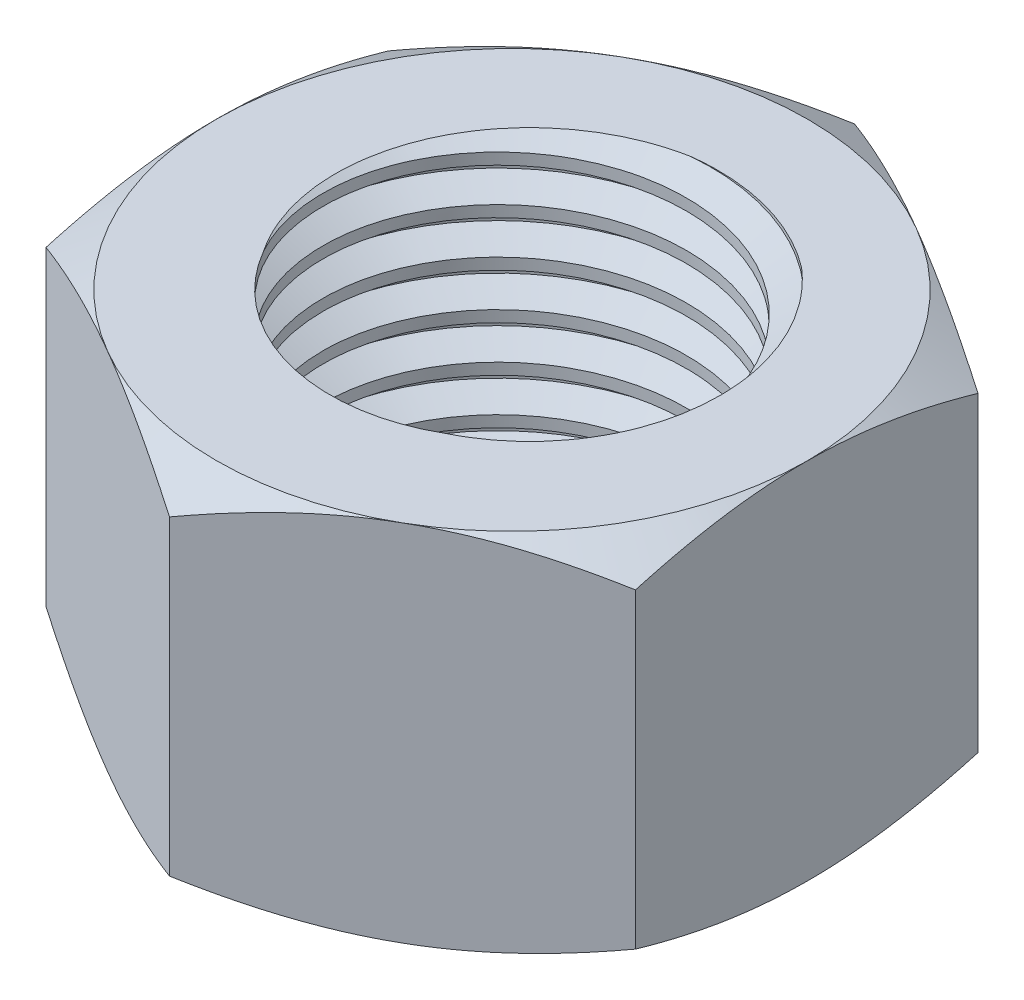
from build123d import *

# Parameters (mm, degrees)
SKETCH1_R           = 12
BOSS_EXTRUDE1_DEPTH = 24
SKETCH2_OUTSIDE_W   = 137.064
SKETCH2_OUTSIDE_H   = 143.026
SKETCH2_OUTSIDE_R   = 19.5
CUT_EXTRUDE1_DEPTH  = 24
CUT_EXTRUDE1_DRAFT  = -60
SKETCH4_OUTSIDE_W   = 137.064
SKETCH4_OUTSIDE_H   = 143.026
SKETCH4_OUTSIDE_R   = 19.5
CUT_EXTRUDE2_DEPTH  = 24
CUT_EXTRUDE2_DRAFT  = -60
THREAD1_PITCH       = 3


with BuildPart() as part:
    # Sketch1 → Boss-Extrude1 (new body)
    with BuildSketch(Plane(origin=(0, 0, 0), x_dir=(1, 0, 0), z_dir=(0, 1, 0))):
        Polygon((-19.535859678, -11.195989757), (-0.071918289, -22.516545644), (19.463941389, -11.320555887), (19.535859678, 11.195989757), (0.071918289, 22.516545644), (-19.463941389, 11.320555887), align=None)
        with Locations(Location((0, 0, 0), (0, 0, 270))):
            Circle(SKETCH1_R, mode=Mode.SUBTRACT)
    extrude(amount=BOSS_EXTRUDE1_DEPTH)


with BuildPart() as cut_extrude1_tool:
    # Sketch2 outside → Cut-Extrude1 (with draft: the straight prism first)
    with BuildSketch(Plane(origin=(0, 24, 0), x_dir=(1, 0, 0), z_dir=(0, 1, 0))):
        Rectangle(SKETCH2_OUTSIDE_W, SKETCH2_OUTSIDE_H)
        Circle(SKETCH2_OUTSIDE_R, mode=Mode.SUBTRACT)
    extrude(amount=-CUT_EXTRUDE1_DEPTH)
    # Cut-Extrude1: the draft: its side faces are tilted about the plane it starts from
    cut_extrude1_sides = [cut_extrude1_tool.faces().sort_by_distance(p)[0] for p in [
        (0, 12, 71.513),
        (68.532, 12, 0),
        (0, 12, -71.513),
        (-68.532, 12, 0),
        (-19.5, 12, 0),
    ]]
    draft(cut_extrude1_sides, Plane(origin=(0, 24, 0), x_dir=(1, 0, 0), z_dir=(0, 1, 0)), CUT_EXTRUDE1_DRAFT)


with BuildPart() as part_1:
    add(part.part)

    # Cut-Extrude1: cut by cut_extrude1_tool
    add(cut_extrude1_tool.part, mode=Mode.SUBTRACT)


with BuildPart() as cut_extrude2_tool:
    # Sketch4 outside → Cut-Extrude2 (with draft: the straight prism first)
    with BuildSketch(Plane.XZ):
        Rectangle(SKETCH4_OUTSIDE_W, SKETCH4_OUTSIDE_H)
        Circle(SKETCH4_OUTSIDE_R, mode=Mode.SUBTRACT)
    extrude(amount=-CUT_EXTRUDE2_DEPTH)
    # Cut-Extrude2: the draft: its side faces are tilted about the plane it starts from
    cut_extrude2_sides = [cut_extrude2_tool.faces().sort_by_distance(p)[0] for p in [
        (0, 12, -71.513),
        (68.532, 12, 0),
        (0, 12, 71.513),
        (-68.532, 12, 0),
        (-19.5, 12, 0),
    ]]
    draft(cut_extrude2_sides, Plane.XZ, CUT_EXTRUDE2_DRAFT)


with BuildPart() as part_2:
    add(part_1.part)

    # Cut-Extrude2: cut by cut_extrude2_tool
    add(cut_extrude2_tool.part, mode=Mode.SUBTRACT)

    # Thread1: the profile of Thread Profile4 profile screwed along a right-hand helix of 10 turns, 10 arcs to a turn; built about Z, then put on its axis
    thread1_z = Axis((0, 0, 0), (0, 0, 1))
    thread1_corners = [(11.9997, 0, -0.000173205), (13.623797625, 0, 0.937499996), (13.623797625, 0, 1.312499996), (11.9997, 0, 2.250173197)]
    with BuildLine(mode=Mode.PRIVATE) as thread1_profile:
        Line(thread1_corners[0], thread1_corners[1])
        Line(thread1_corners[1], thread1_corners[2])
        Line(thread1_corners[2], thread1_corners[3])
        Line(thread1_corners[3], thread1_corners[0])
    thread1_cap = Face(thread1_profile.wire())
    thread1_turn_angles = [0, 18, 36, 54, 72, 90, 108, 126, 144, 162, 180, 198, 216, 234, 252, 270, 288, 306, 324, 342, 360]
    thread1_turn_weights = [1, 0.9510565162951535, 1, 0.9510565162951535, 1, 0.9510565162951535, 1, 0.9510565162951535, 1, 0.9510565162951535, 1, 0.9510565162951535, 1, 0.9510565162951535, 1, 0.9510565162951535, 1, 0.9510565162951535, 1, 0.9510565162951535, 1]
    thread1_turn_rails = [Edge.make_bspline([Vector(p[0], p[1], 0).rotate(thread1_z, thread1_turn_angles[k]) / thread1_turn_weights[k] + Vector(0, 0, p[2] + THREAD1_PITCH * thread1_turn_angles[k] / 360) for k in range(21)], [0, 0, 0, 1, 1, 2, 2, 3, 3, 4, 4, 5, 5, 6, 6, 7, 7, 8, 8, 9, 9, 10, 10, 10], 2, thread1_turn_weights) for p in thread1_corners]
    thread1_turn_sides = [Face.make_surface_from_curves(thread1_turn_rails[p[0]], thread1_turn_rails[p[1]]) for p in [(0, 1), (1, 2), (2, 3), (3, 0)]]
    thread1 = Plane(origin=(0, 29, 0), x_dir=(-1, 0, 0), z_dir=(0, -1, 0)) * Solid(Shell([*[p.moved(Location((0, 0, THREAD1_PITCH * i))) for i in range(10) for p in thread1_turn_sides], thread1_cap, thread1_cap.rotate(thread1_z, 3600).moved(Location((0, 0, THREAD1_PITCH * 3600 / 360)))]))
    add(thread1, mode=Mode.SUBTRACT)


solid = part_2.part
